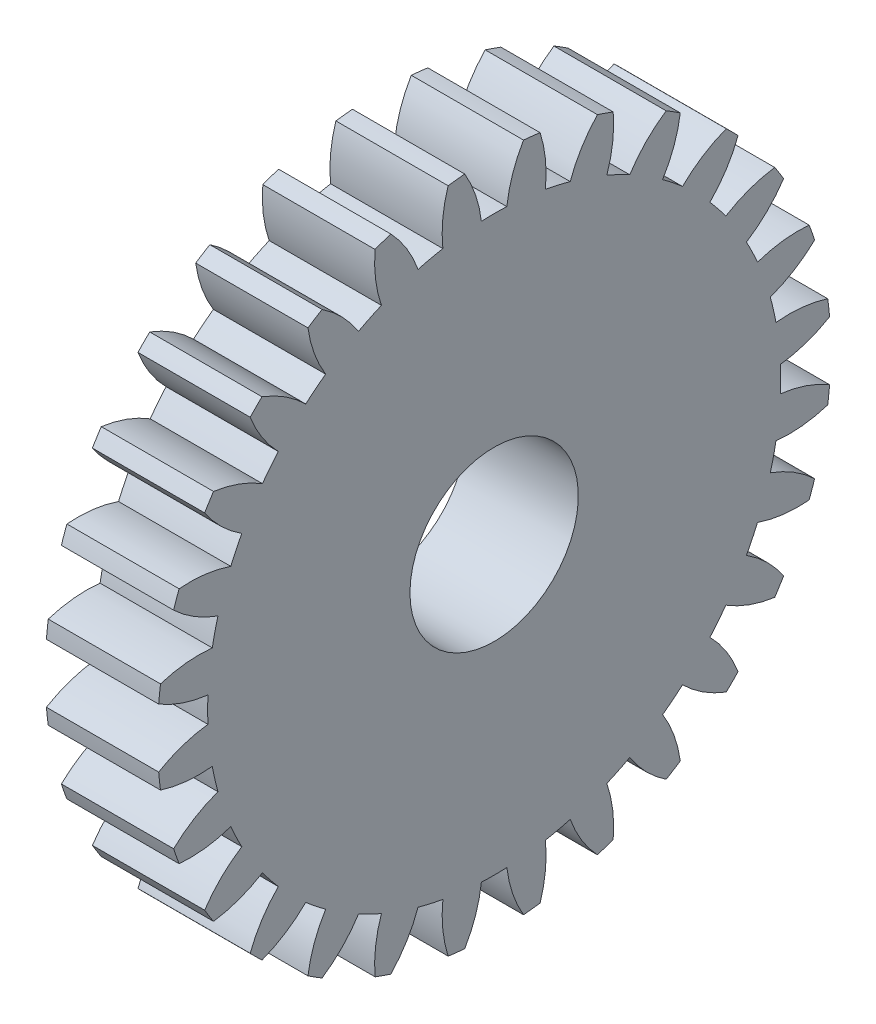
from build123d import *

# Parameters (mm, degrees)
BASPROSKE_W     = 6.35
BASPROSKE_H     = 19.05
TOOTHCUT_DEPTH  = 28.679008291
TEETHCUTS_COUNT = 28
TEETHCUTS_ANGLE = 347.142857143
BORSKE_R        = 4.7625
BORE_DEPTH      = 50.8000508


with BuildPart() as part:
    # BasProSke → Base-Revolve (revolve)
    with BuildSketch(Plane(origin=(0, 0, 0), x_dir=(1, 0, 0), z_dir=(0, 1, 0))):
        with Locations((3.175, 9.525)):
            Rectangle(BASPROSKE_W, BASPROSKE_H)
    revolve(axis=Axis((-10, 0, 0), (1, 0, 0)))

    # TooCutSke → ToothCut (cut, through all)
    with BuildSketch(Plane(origin=(0, 0, 0), x_dir=(0, 0, -1), z_dir=(1, 0, 0))):
        with BuildLine():
            ThreePointArc((0.720316391, 16.189183158), (0, 16.2052), (-0.720316391, 16.189183158))
            ThreePointArc((-0.720316391, 16.189183158), (-1.05059292, 17.645879373), (-1.677830593, 19.001467566))
            ThreePointArc((-1.677830593, 19.001467566), (0, 19.0754), (1.677830593, 19.001467566))
            ThreePointArc((1.677830593, 19.001467566), (1.05059292, 17.645879373), (0.720316391, 16.189183158))
        make_face()
    toothcut = extrude(amount=TOOTHCUT_DEPTH, mode=Mode.SUBTRACT)

    # TeethCuts: ToothCut ×28 about axis
    teethcuts_axis = Axis((-10, 0, 0), (1, 0, 0))
    for i in range(1, TEETHCUTS_COUNT):
        add(toothcut.rotate(teethcuts_axis, i * TEETHCUTS_ANGLE / (TEETHCUTS_COUNT - 1)), mode=Mode.SUBTRACT)

    # BorSke → Bore (cut, symmetric)
    with BuildSketch(Plane(origin=(0, 0, 0), x_dir=(0, 0, -1), z_dir=(1, 0, 0))):
        Circle(BORSKE_R)
    extrude(amount=BORE_DEPTH, both=True, mode=Mode.SUBTRACT)


solid = part.part
